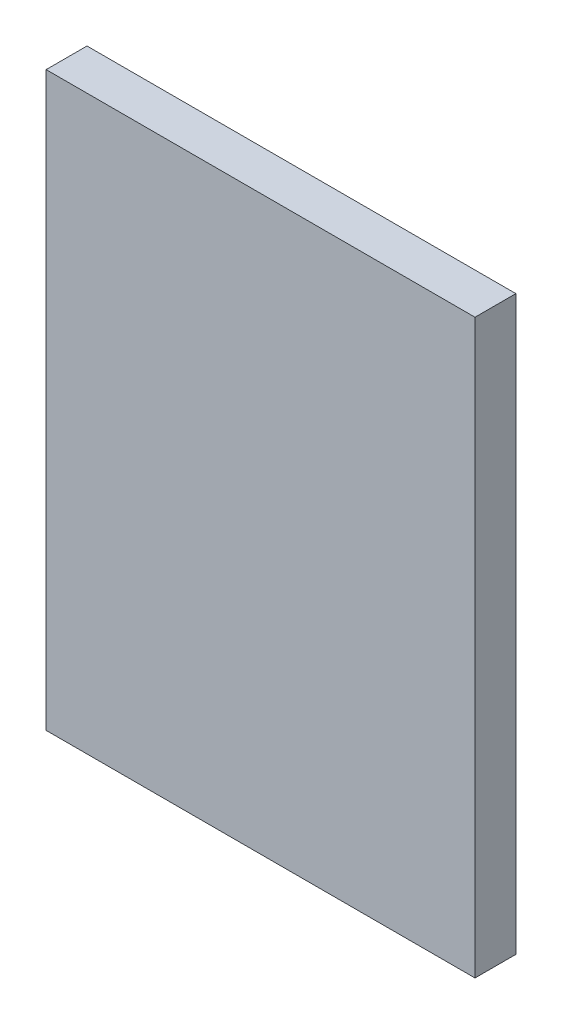
from build123d import *

# Parameters (mm, degrees)
M3_PCB_STANDOFFS_R    = 4.105787176
M3_PCB_STANDOFFS_R_2  = 1.6
BOSS_EXTRUDE1_DEPTH   = 5
BOSS_EXTRUDE1_2_DEPTH = 5
BOSS_EXTRUDE1_3_DEPTH = 5
BOSS_EXTRUDE1_4_DEPTH = 5
BASE_W                = 52.46
BASE_H                = 70
BOSS_EXTRUDE2_DEPTH   = 5


with BuildPart() as part:
    # m3_pcb_standoffs → Boss-Extrude1 (new body)
    with BuildSketch(Plane.XY):
        with Locations((12.7, 35.56)):
            Circle(M3_PCB_STANDOFFS_R)
        with Locations((12.7, 35.56)):
            Circle(M3_PCB_STANDOFFS_R_2, mode=Mode.SUBTRACT)
    extrude(amount=BOSS_EXTRUDE1_DEPTH)



with BuildPart() as body_2:
    # m3_pcb_standoffs → Boss-Extrude1 2 (new body)
    with BuildSketch(Plane.XY):
        with Locations((35.56, 35.56)):
            Circle(M3_PCB_STANDOFFS_R)
        with Locations((35.56, 35.56)):
            Circle(M3_PCB_STANDOFFS_R_2, mode=Mode.SUBTRACT)
    extrude(amount=BOSS_EXTRUDE1_2_DEPTH)


with BuildPart() as body_3:
    # m3_pcb_standoffs → Boss-Extrude1 3 (new body)
    with BuildSketch(Plane.XY):
        with Locations((35.56, 5.08)):
            Circle(M3_PCB_STANDOFFS_R)
        with Locations((35.56, 5.08)):
            Circle(M3_PCB_STANDOFFS_R_2, mode=Mode.SUBTRACT)
    extrude(amount=BOSS_EXTRUDE1_3_DEPTH)


with BuildPart() as body_4:
    # m3_pcb_standoffs → Boss-Extrude1 4 (new body)
    with BuildSketch(Plane.XY):
        with Locations((12.7, 5.08)):
            Circle(M3_PCB_STANDOFFS_R)
        with Locations((12.7, 5.08)):
            Circle(M3_PCB_STANDOFFS_R_2, mode=Mode.SUBTRACT)
    extrude(amount=BOSS_EXTRUDE1_4_DEPTH)


with BuildPart() as part_1:
    add(part.part)

    add(body_2.part)  # Boss-Extrude2 merges body 2

    add(body_3.part)  # Boss-Extrude2 merges body 3

    add(body_4.part)  # Boss-Extrude2 merges body 4
    # Base → Boss-Extrude2 (add)
    with BuildSketch(Plane.XY.offset(5)):
        with Locations((21.23, 20)):
            Rectangle(BASE_W, BASE_H)
    extrude(amount=BOSS_EXTRUDE2_DEPTH)


solid = part_1.part
